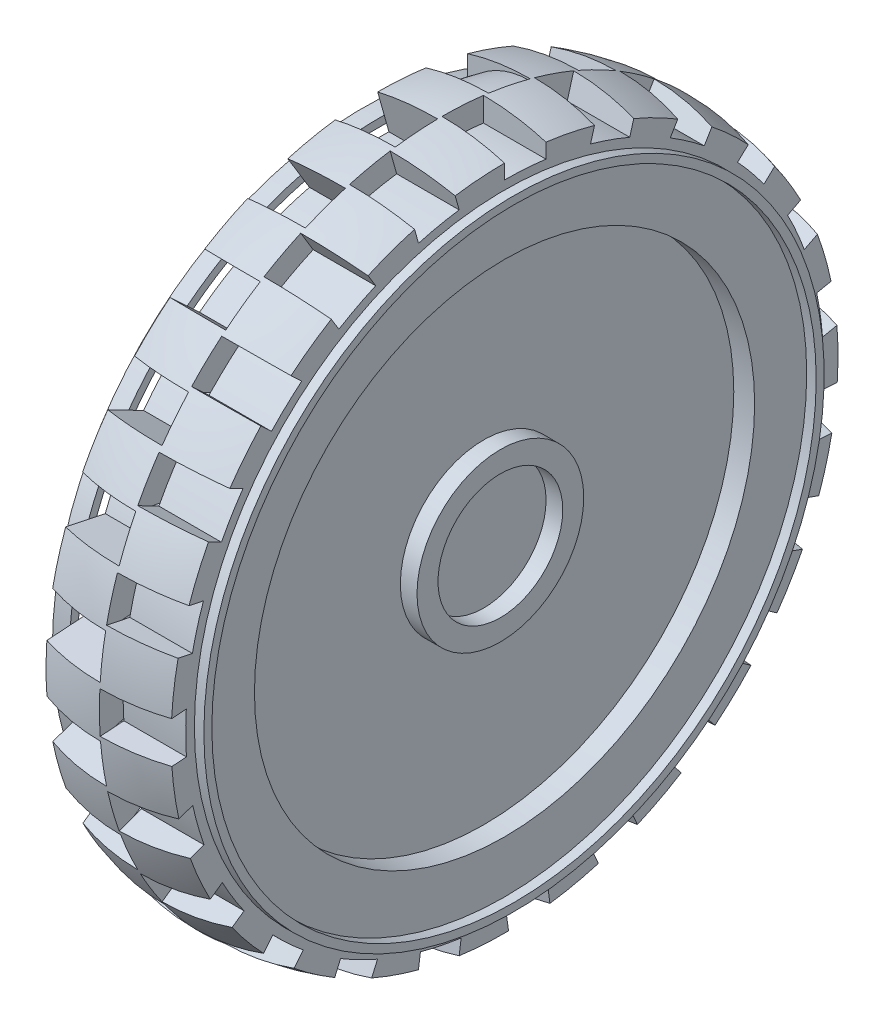
from build123d import *

# Parameters (mm, degrees)
TREADS1_DEPTH           = 9.525
CIRCPATTERN_RIGHT_COUNT = 23
TREADS2_START           = -9.525
TREADS2_DEPTH           = 9.525
CIRCPATTERN_LEFT_COUNT  = 23
SKETCH9_R               = 12.7
SKETCH9_R_2             = 9.4999937
SHAFT_COMPARTMENT_DEPTH = 2.54


# Read off the part's stored shape, not the designer's step: Treads1, Treads2
with BuildPart() as part:
    # Sketch1 → Wheel (revolve)
    with BuildSketch(Plane.XY, mode=Mode.PRIVATE) as wheel_sk:
        with BuildLine():
            Line((-9.525, 58.400757576), (-9.525, 45.700757576))
            Line((-9.525, 45.700757576), (-6.35, 45.700757576))
            Line((-6.35, 45.700757576), (-6.35, 7.600757576))
            Line((-6.35, 7.600757576), (6.35, 7.600757576))
            Line((6.35, 7.600757576), (6.35, 45.700757576))
            Line((6.35, 45.700757576), (9.525, 45.700757576))
            Line((9.525, 45.700757576), (9.525, 58.400757576))
            ThreePointArc((9.525, 58.400757576), (0, 59.79903443), (-9.525, 58.400757576))
        make_face()
    revolve(wheel_sk.sketch.rotate(Axis((-85.051515152, 7.600757576, 0), (1, 0, 0)), 90), axis=Axis((-85.051515152, 7.600757576, 0), (1, 0, 0)))


with BuildPart() as body_2:
    # Sketch2 → Revolve2 (revolve)
    with BuildSketch(Plane.XY, mode=Mode.PRIVATE) as revolve2_sk:
        with BuildLine():
            Line((-9.525, 54.850239736), (-12.104513909, 54.850239736))
            Line((-12.104513909, 54.850239736), (-12.104513909, 53.635774625))
            Line((-12.104513909, 53.635774625), (-9.525, 53.635774625))
            ThreePointArc((-9.525, 53.635774625), (0, 58.36428347), (9.525, 53.635774625))
            Line((9.525, 53.635774625), (10.968417747, 53.635774625))
            Line((10.968417747, 53.635774625), (10.968417747, 54.850239736))
            Line((10.968417747, 54.850239736), (9.525, 54.850239736))
            ThreePointArc((9.525, 54.850239736), (0, 59.543067272), (-9.525, 54.850239736))
        make_face()
    revolve(revolve2_sk.sketch.rotate(Axis((-85.051515152, 7.600757576, 0), (1, 0, 0)), 90), axis=Axis((-85.051515152, 7.600757576, 0), (1, 0, 0)))


with BuildPart() as treads1_tool:
    # Treads1 outline → Treads1 (new body)
    with BuildSketch(Plane.YZ):
        with BuildLine():
            ThreePointArc((56.175774625, 0), (56.07261336, -3.164092), (55.763567742, -6.31474451))
            Line((55.763567742, -6.31474451), (60, -6.31474451))
            Line((60, -6.31474451), (60, 0))
            Line((60, 0), (56.175774625, 0))
        make_face()
    treads1 = extrude(amount=TREADS1_DEPTH)


with BuildPart() as part_1:
    add(part.part)

    # Treads1: cut by treads1_tool
    add(treads1_tool.part, mode=Mode.SUBTRACT)


with BuildPart() as body_2_1:
    add(body_2.part)

    # Treads1: cut by treads1_tool
    add(treads1_tool.part, mode=Mode.SUBTRACT)


with BuildPart() as circpattern_right_tool:
    # CircPattern Right: Treads1 ×23 about axis
    circpattern_right_axis = Axis((0, 7.600757576, 0), (1, 0, 0))
    for i in range(1, CIRCPATTERN_RIGHT_COUNT):
        add(treads1.rotate(circpattern_right_axis, i * 360 / CIRCPATTERN_RIGHT_COUNT))


with BuildPart() as part_2:
    add(part_1.part)

    # CircPattern Right: cut by circpattern_right_tool
    add(circpattern_right_tool.part, mode=Mode.SUBTRACT)

    # Treads2 outline → Treads2 (cut)
    with BuildSketch(Plane.YZ.offset(TREADS2_START)):
        with BuildLine():
            Line((60, -7.089298284), (51.744609298, -7.089298284))
            ThreePointArc((51.744609298, -7.089298284), (51.109583525, -10.291737441), (50.242556983, -13.439298284))
            Line((50.242556983, -13.439298284), (60, -13.439298284))
            Line((60, -13.439298284), (60, -7.089298284))
        make_face()
    treads2 = extrude(amount=TREADS2_DEPTH, mode=Mode.SUBTRACT)


with BuildPart() as body_2_2:
    add(body_2_1.part)

    # CircPattern Right: cut by circpattern_right_tool
    add(circpattern_right_tool.part, mode=Mode.SUBTRACT)


with BuildPart() as circpattern_left_tool:
    # CircPattern Left: Treads2 ×23 about axis
    circpattern_left_axis = Axis((0, 7.600757576, 0), (1, 0, 0))
    for i in range(1, CIRCPATTERN_LEFT_COUNT):
        add(treads2.rotate(circpattern_left_axis, i * 360 / CIRCPATTERN_LEFT_COUNT))


with BuildPart() as part_3:
    add(part_2.part)

    # CircPattern Left: cut by circpattern_left_tool
    add(circpattern_left_tool.part, mode=Mode.SUBTRACT)


with BuildPart() as body_2_3:
    add(body_2_2.part)

    # CircPattern Left: cut by circpattern_left_tool
    add(circpattern_left_tool.part, mode=Mode.SUBTRACT)


    add(part_3.part)  # Shaft Compartment merges part
    # Sketch9 → Shaft Compartment (add)
    with BuildSketch(Plane(origin=(6.35, 0, 0), x_dir=(0, 0, -1), z_dir=(1, 0, 0))):
        with Locations(Location((0, 7.600757576, 0), (0, 0, 180))):
            Circle(SKETCH9_R)
        with Locations((0, 7.600757576)):
            Circle(SKETCH9_R_2, mode=Mode.SUBTRACT)
    extrude(amount=SHAFT_COMPARTMENT_DEPTH)


solid = body_2_3.part
